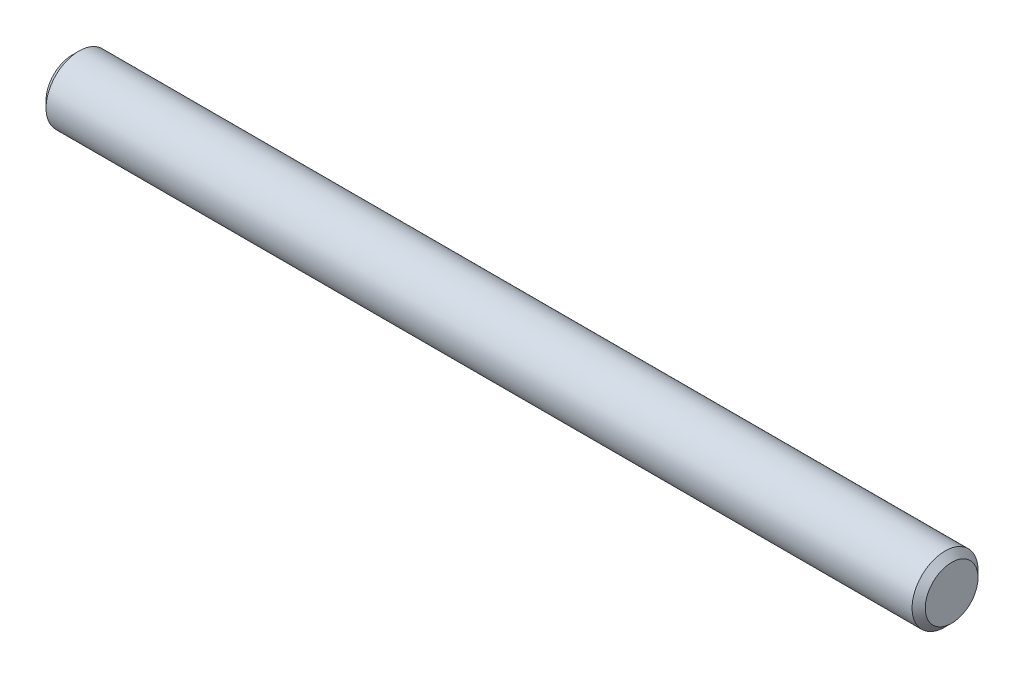
from build123d import *

# Parameters (mm, degrees)
BOSS_EXTRUDE1_DEPTH      = 10
BOSS_EXTRUDE1_DEPTH_BACK = 10
SKETCH1_R                = 0.75
CHAMFER1_SIZE            = 0.15


with BuildPart() as part:
    # Sketch1 → Boss-Extrude1 (new, two sides: drawn at the far end of the back side and taken through both)
    with BuildSketch(Plane(origin=(0, 0, 0), x_dir=(0, 0, -1), z_dir=(1, 0, 0)).offset(-BOSS_EXTRUDE1_DEPTH_BACK)):
        Circle(SKETCH1_R)
    extrude(amount=BOSS_EXTRUDE1_DEPTH + BOSS_EXTRUDE1_DEPTH_BACK)

    # Chamfer1
    chamfer1_edges = [part.edges().sort_by_distance(p)[0] for p in [
        (-10, 0, 0.75),
        (10, 0, 0.75),
    ]]
    chamfer(chamfer1_edges, length=CHAMFER1_SIZE)


solid = part.part
